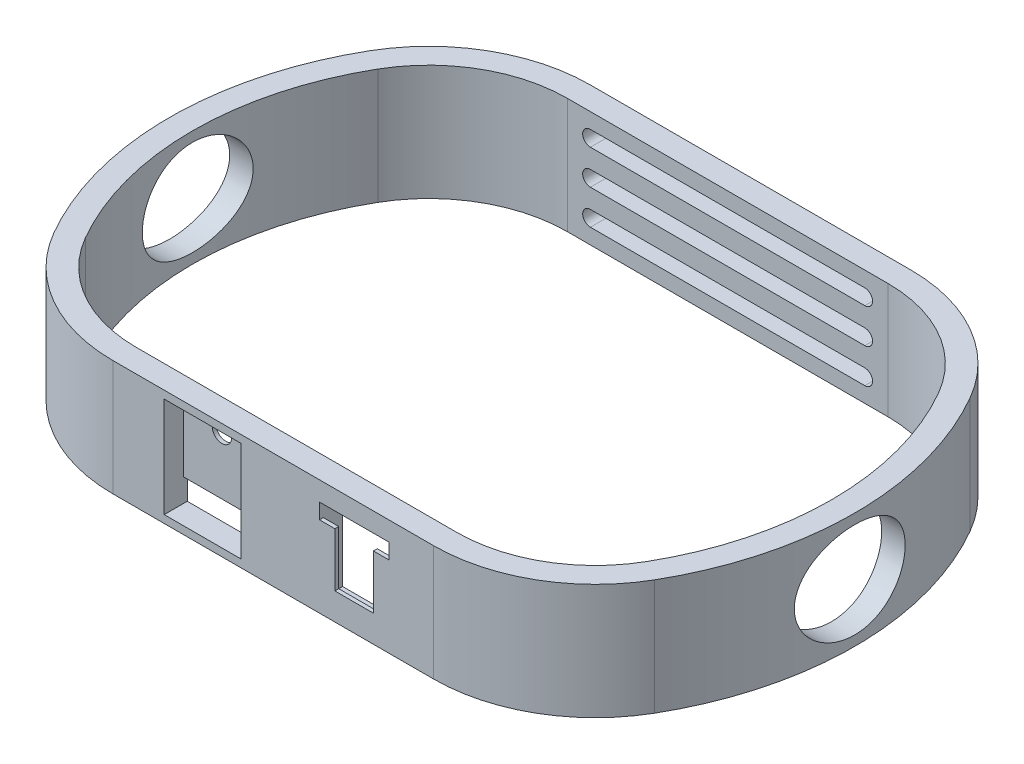
from build123d import *

# Parameters (mm, degrees)
SKETCH_1_W           = 89
SKETCH_1_H           = 62
EXTRUDE_1_DEPTH      = 15
CUT_EXTRUDE_START    = -15.000001
SKETCH_2_W           = 114.345269922
SKETCH_2_H           = 82.741202996
CUT_EXTRUDE_2_DEPTH  = 15.000002
CUT_EXTRUDE_3_REACH  = 70.225
CUT_EXTRUDE_6_REACH  = 84.425
SKETCH_4_W           = 9
SKETCH_4_H           = 11
FILLET_1_R           = 0.5
CUT_EXTRUDE_7_REACH  = 82.193
EXTRUDE_2_DEPTH      = 0.5
SKETCH_11_W          = 10
SKETCH_11_H          = 13
CUT_EXTRUDE_10_DEPTH = 2.5
SKETCH_12_R          = 1.25
SKETCH_12_W          = 10
SKETCH_12_H          = 3
CUT_EXTRUDE_11_DEPTH = 2.5
CUT_EXTRUDE_12_REACH = 84.425
CUT_EXTRUDE_START_2  = -52.200000102
CUT_EXTRUDE_13_DEPTH = 88.999999964


with BuildPart() as part:
    # 草图1 → 凸台-拉伸1 (new body)
    with BuildSketch(Plane(origin=(0, 0, 0), x_dir=(1, 0, 0), z_dir=(0, 1, 0))):
        with Locations((-7.7, -10.288888889)):
            Rectangle(SKETCH_1_W, SKETCH_1_H)
    extrude(amount=EXTRUDE_1_DEPTH)

    # 草图2 → 切除-拉伸2 (cut)
    with BuildSketch(Plane(origin=(0, 15, 0), x_dir=(1, 0, 0), z_dir=(0, 1, 0)).offset(CUT_EXTRUDE_START)):
        with Locations((-11.341983823, -7.488413354)):
            Rectangle(SKETCH_2_W, SKETCH_2_H)
        with BuildLine():
            Line((-28.520508076, 20.711111111), (13.120508076, 20.711111111))
            ThreePointArc((13.120508076, 20.711111111), (23.620508076, 17.897644591), (31.307041555, 10.211111111))
            ThreePointArc((31.307041555, 10.211111111), (36.8, -10.288888889), (31.307041555, -30.788888889))
            ThreePointArc((31.307041555, -30.788888889), (23.620508076, -38.475422368), (13.120508076, -41.288888889))
            Line((13.120508076, -41.288888889), (-28.520508076, -41.288888889))
            ThreePointArc((-28.520508076, -41.288888889), (-39.020508076, -38.475422368), (-46.707041555, -30.788888889))
            ThreePointArc((-46.707041555, -30.788888889), (-52.2, -10.288888889), (-46.707041555, 10.211111111))
            ThreePointArc((-46.707041555, 10.211111111), (-39.020508076, 17.897644591), (-28.520508076, 20.711111111))
        make_face(mode=Mode.SUBTRACT)
    extrude(amount=CUT_EXTRUDE_2_DEPTH, mode=Mode.SUBTRACT)

    # 草图3 → 切除-拉伸3 (cut, up to next)
    with BuildSketch(Plane(origin=(0, 15, 0), x_dir=(1, 0, 0), z_dir=(0, 1, 0)), mode=Mode.PRIVATE) as cut_extrude_3_sk1:
        with BuildLine():
            Line((-28.520508076, -38.288888889), (13.120508076, -38.288888889))
            ThreePointArc((13.120508076, -38.288888889), (22.120508076, -35.877346157), (28.708965344, -29.288888889))
            ThreePointArc((28.708965344, -29.288888889), (33.8, -10.288888889), (28.708965344, 8.711111111))
            ThreePointArc((28.708965344, 8.711111111), (22.120508076, 15.299568379), (13.120508076, 17.711111111))
            Line((13.120508076, 17.711111111), (-28.520508076, 17.711111111))
            ThreePointArc((-28.520508076, 17.711111111), (-37.520508076, 15.299568379), (-44.108965344, 8.711111111))
            ThreePointArc((-44.108965344, 8.711111111), (-49.2, -10.288888889), (-44.108965344, -29.288888889))
            ThreePointArc((-44.108965344, -29.288888889), (-37.520508076, -35.877346157), (-28.520508076, -38.288888889))
        make_face()
    cut_extrude_3_tool1 = extrude(cut_extrude_3_sk1.sketch, amount=-CUT_EXTRUDE_3_REACH, mode=Mode.PRIVATE) & part.part
    add(cut_extrude_3_tool1.solids().sort_by_distance((-7.7, 15, 10.288889))[0], mode=Mode.SUBTRACT)

    # 草图4 → 切除-拉伸6 (cut, up to next)
    with BuildSketch(Plane.XY.offset(41.288888889), mode=Mode.PRIVATE) as cut_extrude_6_sk1:
        with Locations((2.8, 7)):
            Rectangle(SKETCH_4_W, SKETCH_4_H)
    cut_extrude_6_tool1 = extrude(cut_extrude_6_sk1.sketch, amount=-CUT_EXTRUDE_6_REACH, mode=Mode.PRIVATE) & part.part
    add(cut_extrude_6_tool1.solids().sort_by_distance((2.8, 7, 41.288889))[0], mode=Mode.SUBTRACT)

    # 圆角1
    fillet_1_edges = [part.edges().sort_by_distance(p)[0] for p in [
        (7.3, 1.5, 39.788888889),
    ]]
    fillet(fillet_1_edges, radius=FILLET_1_R)

    # 草图7 → 切除-拉伸7 (cut, up to next)
    with BuildSketch(Plane(origin=(0, 0, 38.288888889), x_dir=(-1, 0, 0), z_dir=(0, 0, -1)), mode=Mode.PRIVATE) as cut_extrude_7_sk1:
        Polygon((-7.3, 2.207106781), (-6.592893219, 1.5), (-7.3, 0.792893219), (-8.007106781, 1.5), align=None)
    cut_extrude_7_tool1 = extrude(cut_extrude_7_sk1.sketch, amount=-CUT_EXTRUDE_7_REACH, mode=Mode.PRIVATE) & part.part
    add(cut_extrude_7_tool1.solids().sort_by_distance((7.3, 1.5, 38.288889))[0], mode=Mode.SUBTRACT)

    # 草图8 → 凸台-拉伸2 (add)
    with BuildSketch(Plane.XY.offset(41.288888889)):
        Polygon((-1.7, 1.5), (-1.7, 0), (10.425334972, 0), (10.425334972, 10.5), (7.3, 10.5), (5.3, 10.5), (5.3, 3.5), (0.3, 3.5), (0.3, 10.5), (-1.7, 10.5), align=None)
    extrude(amount=-EXTRUDE_2_DEPTH)

    # 草图11 → 切除-拉伸10 (cut)
    with BuildSketch(Plane.XY.offset(41.288888889)):
        with Locations((-16.870478922, 7.5)):
            Rectangle(SKETCH_11_W, SKETCH_11_H)
    extrude(amount=-CUT_EXTRUDE_10_DEPTH, mode=Mode.SUBTRACT)

    # 草图12 → 切除-拉伸11 (cut)
    with BuildSketch(Plane.XY.offset(38.788888889)):
        with Locations((-16.870478922, 11.5)):
            Circle(SKETCH_12_R)
        with Locations((-16.870478922, 2.5)):
            Rectangle(SKETCH_12_W, SKETCH_12_H)
    extrude(amount=-CUT_EXTRUDE_11_DEPTH, mode=Mode.SUBTRACT)

    # 草图13 → 切除-拉伸12 (cut, up to next)
    with BuildSketch(Plane(origin=(0, 0, -20.711111111), x_dir=(-1, 0, 0), z_dir=(0, 0, -1)), mode=Mode.PRIVATE) as cut_extrude_12_sk1:
        with BuildLine():
            Line((-10.120508076, 13), (25.520508076, 13))
            ThreePointArc((25.520508076, 13), (26.520508076, 12), (25.520508076, 11))
            Line((25.520508076, 11), (-10.120508076, 11))
            ThreePointArc((-10.120508076, 11), (-11.120508076, 12), (-10.120508076, 13))
        make_face()
    cut_extrude_12_tool1 = extrude(cut_extrude_12_sk1.sketch, amount=-CUT_EXTRUDE_12_REACH, mode=Mode.PRIVATE) & part.part
    # 草图13 → 切除-拉伸12 (cut, up to next)
    with BuildSketch(Plane(origin=(0, 0, -20.711111111), x_dir=(-1, 0, 0), z_dir=(0, 0, -1)), mode=Mode.PRIVATE) as cut_extrude_12_sk2:
        with BuildLine():
            Line((-10.120508076, 6.5), (25.520508076, 6.5))
            ThreePointArc((25.520508076, 6.5), (26.520508076, 7.5), (25.520508076, 8.5))
            Line((25.520508076, 8.5), (-10.120508076, 8.5))
            ThreePointArc((-10.120508076, 8.5), (-11.120508076, 7.5), (-10.120508076, 6.5))
        make_face()
    cut_extrude_12_tool2 = extrude(cut_extrude_12_sk2.sketch, amount=-CUT_EXTRUDE_12_REACH, mode=Mode.PRIVATE) & part.part
    # 草图13 → 切除-拉伸12 (cut, up to next)
    with BuildSketch(Plane(origin=(0, 0, -20.711111111), x_dir=(-1, 0, 0), z_dir=(0, 0, -1)), mode=Mode.PRIVATE) as cut_extrude_12_sk3:
        with BuildLine():
            Line((-10.120508076, 2), (25.520508076, 2))
            ThreePointArc((25.520508076, 2), (26.520508076, 3), (25.520508076, 4))
            Line((25.520508076, 4), (-10.120508076, 4))
            ThreePointArc((-10.120508076, 4), (-11.120508076, 3), (-10.120508076, 2))
        make_face()
    cut_extrude_12_tool3 = extrude(cut_extrude_12_sk3.sketch, amount=-CUT_EXTRUDE_12_REACH, mode=Mode.PRIVATE) & part.part
    add(cut_extrude_12_tool1.solids().sort_by_distance((-7.7, 12, -20.711111))[0], mode=Mode.SUBTRACT)
    add(cut_extrude_12_tool2.solids().sort_by_distance((-7.7, 7.5, -20.711111))[0], mode=Mode.SUBTRACT)
    add(cut_extrude_12_tool3.solids().sort_by_distance((-7.7, 3, -20.711111))[0], mode=Mode.SUBTRACT)

    # 切除-拉伸13: read off the stored shape, not the designer's step
    # 切除-拉伸13 outline → 切除-拉伸13 (cut)
    with BuildSketch(Plane(origin=(0, 0, 0), x_dir=(0, 0, -1), z_dir=(1, 0, 0)).offset(CUT_EXTRUDE_START_2)):
        with BuildLine():
            add(Edge.make_bspline(
                [(-17.488888889, 7.5), (-17.488888889, 6.618712307), (-17.038806778, 4.85613692), (-15.30252013, 2.82180753), (-12.943624098, 1.578601929), (-10.288888889, 1.160699036), (-7.634153679, 1.578601929), (-5.275257648, 2.82180753), (-3.538970999, 4.85613692), (-2.863847834, 7.5), (-3.538970999, 10.14386308), (-5.275257648, 12.17819247), (-7.634153679, 13.421398071), (-10.288888889, 13.839300964), (-12.943624098, 13.421398071), (-15.30252013, 12.17819247), (-17.038806778, 10.14386308), (-17.488888889, 8.381287693), (-17.488888889, 7.5)],
                knots=[0, 0, 0, 0, 0.392699082, 0.785398163, 1.178097245, 1.570796327, 1.963495408, 2.35619449, 2.748893572, 3.141592654, 3.534291735, 3.926990817, 4.319689899, 4.71238898, 5.105088062, 5.497787144, 5.890486225, 6.283185307, 6.283185307, 6.283185307, 6.283185307], degree=3))
        make_face()
    extrude(amount=CUT_EXTRUDE_13_DEPTH, mode=Mode.SUBTRACT)


solid = part.part
